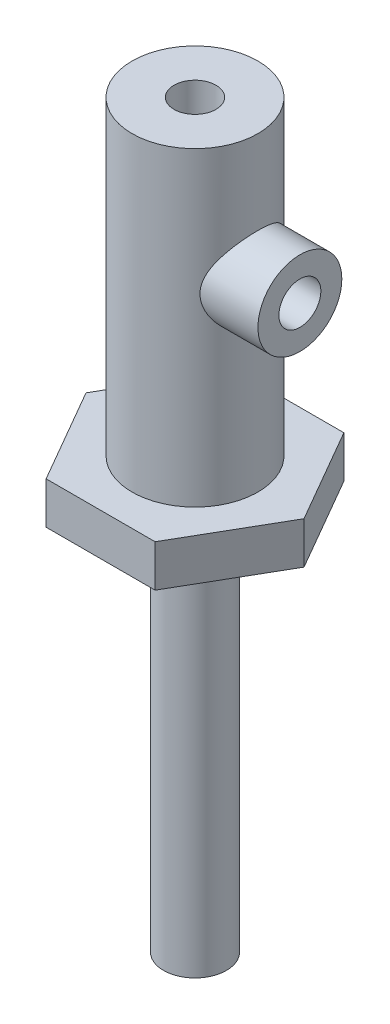
from build123d import *

# Parameters (mm, degrees)
SKETCH1_R                = 3
BOSS_EXTRUDE1_DEPTH      = 16.8
SKETCH2_R                = 1
CUT_EXTRUDE3_DEPTH       = 10.2
BOSS_EXTRUDE2_DEPTH      = 2
SKETCH4_R                = 1.5
BOSS_EXTRUDE3_DEPTH      = 18.5
BOSS_EXTRUDE4_DEPTH      = 2
BOSS_EXTRUDE4_DEPTH_BACK = 1
SKETCH6_R                = 2
SKETCH6_R_2              = 1
SKETCH7_R                = 1.1
CUT_EXTRUDE4_DEPTH       = 3


with BuildPart() as part:
    # Sketch1 → Boss-Extrude1 (new body)
    with BuildSketch(Plane(origin=(0, 0, 0), x_dir=(1, 0, 0), z_dir=(0, 1, 0))):
        Circle(SKETCH1_R)
    extrude(amount=BOSS_EXTRUDE1_DEPTH)

    # Sketch2 → Cut-Extrude3 (cut)
    with BuildSketch(Plane(origin=(0, 16.8, 0), x_dir=(1, 0, 0), z_dir=(0, 1, 0))):
        Circle(SKETCH2_R)
    extrude(amount=-CUT_EXTRUDE3_DEPTH, mode=Mode.SUBTRACT)

    # Sketch3 → Boss-Extrude2 (add)
    with BuildSketch(Plane(origin=(0, 0, 0), x_dir=(-1, 0, 0), z_dir=(0, -1, 0))):
        Polygon((5.196152423, 0), (2.598076211, 4.5), (-2.598076211, 4.5), (-5.196152423, 0), (-2.598076211, -4.5), (2.598076211, -4.5), align=None)
    extrude(amount=-BOSS_EXTRUDE2_DEPTH)

    # Sketch4 → Boss-Extrude3 (add)
    with BuildSketch(Plane(origin=(0, 0, 0), x_dir=(-1, 0, 0), z_dir=(0, -1, 0))):
        Circle(SKETCH4_R)
    extrude(amount=BOSS_EXTRUDE3_DEPTH)

    # Sketch6 → Boss-Extrude4 (add, two sides: drawn at the far end of the back side and taken through both)
    with BuildSketch(Plane(origin=(3, 0, 0), x_dir=(0, 0, -1), z_dir=(1, 0, 0)).offset(-BOSS_EXTRUDE4_DEPTH_BACK)):
        with Locations((0, 10.8)):
            Circle(SKETCH6_R)
        with Locations((0, 10.8)):
            Circle(SKETCH6_R_2, mode=Mode.SUBTRACT)
    extrude(amount=BOSS_EXTRUDE4_DEPTH + BOSS_EXTRUDE4_DEPTH_BACK)

    # Sketch7 → Cut-Extrude4 (cut)
    with BuildSketch(Plane(origin=(3, 0, 0), x_dir=(0, 0, -1), z_dir=(1, 0, 0))):
        with Locations((0, 10.8)):
            Circle(SKETCH7_R)
    extrude(amount=-CUT_EXTRUDE4_DEPTH, mode=Mode.SUBTRACT)


solid = part.part
